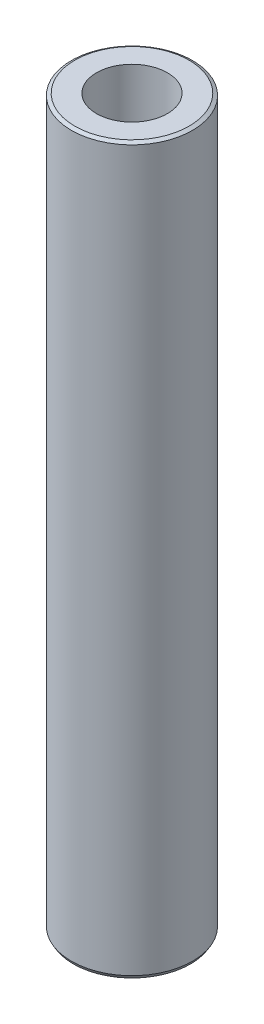
from build123d import *
from OCP.BRepFilletAPI import BRepFilletAPI_MakeChamfer

# Parameters (mm, degrees)
SKETCH1_R           = 7.5
BOSS_EXTRUDE1_DEPTH = 89.776189039
SKETCH2_R           = 4.390031146
CUT_EXTRUDE1_DEPTH  = 91.400575875
CHAMFER1_SIZE       = 0.242798221
CHAMFER1_SIZE2      = 0.420538854


with BuildPart() as part:
    # Sketch1 → Boss-Extrude1 (new body)
    with BuildSketch(Plane(origin=(0, 0, 0), x_dir=(1, 0, 0), z_dir=(0, 1, 0))):
        Circle(SKETCH1_R)
    extrude(amount=BOSS_EXTRUDE1_DEPTH)

    # Sketch2 → Cut-Extrude1 (cut, through all)
    with BuildSketch(Plane(origin=(0, 0, 0), x_dir=(1, 0, 0), z_dir=(0, 1, 0))):
        Circle(SKETCH2_R)
    extrude(amount=CUT_EXTRUDE1_DEPTH, mode=Mode.SUBTRACT)

    # Chamfer1: one chamfer whose edges measure the first distance from different faces: ONE call of the kernel's chamfer builder (chamfer() names one face for all edges)
    chamfer1_edges_1 = [part.edges().sort_by_distance(p)[0] for p in [
        (-7.5, 89.776189039, 0),
    ]]
    chamfer1_side_1 = [part.faces().sort_by_distance(p)[0] for p in [
        (-7.5, 44.88809452, 0),
    ]]
    chamfer1_edges_2 = [part.edges().sort_by_distance(p)[0] for p in [
        (-7.5, 0, 0),
    ]]
    chamfer1_side_2 = [part.faces().sort_by_distance(p)[0] for p in [
        (-7.287867966, 0, 0),
    ]]
    chamfer1 = BRepFilletAPI_MakeChamfer(part.part.solid().wrapped)
    for e in chamfer1_edges_1:
        chamfer1.Add(CHAMFER1_SIZE, CHAMFER1_SIZE2, e.wrapped, chamfer1_side_1[0].wrapped)  # the first distance lies on this face
    for e in chamfer1_edges_2:
        chamfer1.Add(CHAMFER1_SIZE, CHAMFER1_SIZE2, e.wrapped, chamfer1_side_2[0].wrapped)  # the first distance lies on this face
    add(Compound.cast(chamfer1.Shape()), mode=Mode.REPLACE)


solid = part.part
